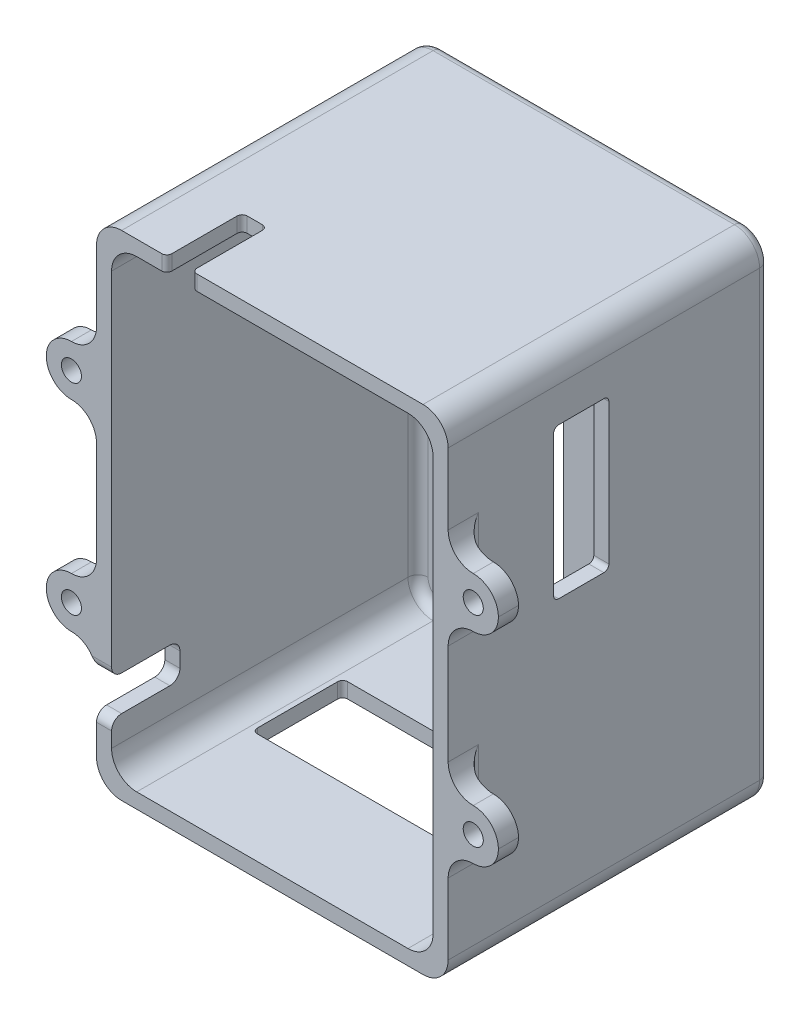
from build123d import *

# Parameters (mm, degrees)
SKETCH1_W           = 64
SKETCH1_H           = 92.29356787
SKETCH1_W_2         = 10
SKETCH1_H_2         = 76.29356787
BOSS_EXTRUDE1_DEPTH = 3
SKETCH1_3_W         = 70
SKETCH1_3_H         = 98.29356787
SKETCH1_3_W_2       = 64
SKETCH1_3_H_2       = 92.29356787
BOSS_EXTRUDE2_DEPTH = 64
FILLET1_R           = 2
FILLET2_R           = 5
SKETCH2_W           = 52
SKETCH2_H           = 18
CUT_EXTRUDE1_DEPTH  = 64
FILLET3_R           = 1
SKETCH3_W           = 11
SKETCH3_H           = 30
CUT_EXTRUDE2_DEPTH  = 45
FILLET4_R           = 1
SKETCH4_W           = 5
SKETCH4_H           = 15
CUT_EXTRUDE3_DEPTH  = 81
FILLET5_R           = 1
SKETCH5_W           = 10
SKETCH5_H           = 10
SKETCH5_R           = 2
BOSS_EXTRUDE3_DEPTH = 4
FILLET6_R           = 5
FILLET7_R           = 5
FILLET8_R           = 2
FILLET9_R           = 2
FILLET10_R          = 2
SKETCH6_W           = 13.6
SKETCH6_H           = 7
CUT_EXTRUDE4_DEPTH  = 48
FILLET11_R          = 2


with BuildPart() as part:
    # Sketch1 → Boss-Extrude1 (new body)
    with BuildSketch(Plane.XY):
        Rectangle(SKETCH1_W, SKETCH1_H)
        with Locations((-24, 0)):
            Rectangle(SKETCH1_W_2, SKETCH1_H_2, mode=Mode.SUBTRACT)
        with Locations((-8, 0)):
            Rectangle(SKETCH1_W_2, SKETCH1_H_2, mode=Mode.SUBTRACT)
        with Locations((8, 0)):
            Rectangle(SKETCH1_W_2, SKETCH1_H_2, mode=Mode.SUBTRACT)
        with Locations((24, 0)):
            Rectangle(SKETCH1_W_2, SKETCH1_H_2, mode=Mode.SUBTRACT)
    extrude(amount=BOSS_EXTRUDE1_DEPTH)

    # Sketch1<3> → Boss-Extrude2 (add)
    with BuildSketch(Plane.XY):
        Rectangle(SKETCH1_3_W, SKETCH1_3_H)
        Rectangle(SKETCH1_3_W_2, SKETCH1_3_H_2, mode=Mode.SUBTRACT)
    extrude(amount=BOSS_EXTRUDE2_DEPTH)

    # Fillet1
    fillet1_edges = [part.edges().sort_by_distance(p)[0] for p in [
        (-19, -38.146783935, 1.5),
        (-19, 38.146783935, 1.5),
        (-29, 38.146783935, 1.5),
        (-29, -38.146783935, 1.5),
        (-13, 38.146783935, 1.5),
        (-13, -38.146783935, 1.5),
        (-3, -38.146783935, 1.5),
        (-3, 38.146783935, 1.5),
        (3, 38.146783935, 1.5),
        (3, -38.146783935, 1.5),
        (13, -38.146783935, 1.5),
        (13, 38.146783935, 1.5),
        (19, 38.146783935, 1.5),
        (19, -38.146783935, 1.5),
        (29, -38.146783935, 1.5),
        (29, 38.146783935, 1.5),
    ]]
    fillet(fillet1_edges, radius=FILLET1_R)

    # Fillet2
    fillet2_edges = [part.edges().sort_by_distance(p)[0] for p in [
        (32, -46.146783935, 33.5),
        (-32, -46.146783935, 33.5),
        (-32, 46.146783935, 33.5),
        (-35, 49.146783935, 32),
        (-35, -49.146783935, 32),
        (35, -49.146783935, 32),
        (35, 49.146783935, 32),
        (32, 46.146783935, 33.5),
    ]]
    fillet(fillet2_edges, radius=FILLET2_R)

    # Sketch2 → Cut-Extrude1 (cut)
    with BuildSketch(Plane(origin=(0, 0, 0), x_dir=(1, 0, 0), z_dir=(0, 1, 0))):
        with Locations((0, -33)):
            Rectangle(SKETCH2_W, SKETCH2_H)
    extrude(amount=-CUT_EXTRUDE1_DEPTH, mode=Mode.SUBTRACT)

    # Fillet3
    fillet3_edges = [part.edges().sort_by_distance(p)[0] for p in [
        (-26, -47.646783935, 42),
        (-26, -47.646783935, 24),
        (26, -47.646783935, 24),
        (26, -47.646783935, 42),
    ]]
    fillet(fillet3_edges, radius=FILLET3_R)

    # Sketch3 → Cut-Extrude2 (cut)
    with BuildSketch(Plane(origin=(0, 0, 0), x_dir=(0, 0, -1), z_dir=(1, 0, 0))):
        with Locations((-37.5, 22.146783935)):
            Rectangle(SKETCH3_W, SKETCH3_H)
    extrude(amount=CUT_EXTRUDE2_DEPTH, mode=Mode.SUBTRACT)

    # Fillet4
    fillet4_edges = [part.edges().sort_by_distance(p)[0] for p in [
        (33.5, 37.146783935, 43),
        (33.5, 7.146783935, 43),
        (33.5, 7.146783935, 32),
        (33.5, 37.146783935, 32),
    ]]
    fillet(fillet4_edges, radius=FILLET4_R)

    # Sketch4 → Cut-Extrude3 (cut)
    with BuildSketch(Plane(origin=(0, 0, 0), x_dir=(1, 0, 0), z_dir=(0, 1, 0))):
        with Locations((-18.5, -56.5)):
            Rectangle(SKETCH4_W, SKETCH4_H)
    extrude(amount=CUT_EXTRUDE3_DEPTH, mode=Mode.SUBTRACT)

    # Fillet5
    fillet5_edges = [part.edges().sort_by_distance(p)[0] for p in [
        (-16, 47.646783935, 64),
        (-21, 47.646783935, 64),
        (-16, 47.646783935, 49),
        (-21, 47.646783935, 49),
    ]]
    fillet(fillet5_edges, radius=FILLET5_R)

    # Sketch5 → Boss-Extrude3 (add)
    # profile 1 of 4: a face of its own
    with BuildSketch(Plane.XY.offset(64)):
        with Locations((40, 20)):
            Rectangle(SKETCH5_W, SKETCH5_H)
        with Locations((40, 20)):
            Circle(SKETCH5_R, mode=Mode.SUBTRACT)
    # profile 2 of 4: a face of its own
    with BuildSketch(Plane.XY.offset(64)):
        with Locations((40, -20)):
            Rectangle(SKETCH5_W, SKETCH5_H)
        with Locations((40, -20)):
            Circle(SKETCH5_R, mode=Mode.SUBTRACT)
    # profile 3 of 4: a face of its own
    with BuildSketch(Plane.XY.offset(64)):
        with Locations((-40, -20)):
            Rectangle(SKETCH5_W, SKETCH5_H)
        with Locations((-40, -20)):
            Circle(SKETCH5_R, mode=Mode.SUBTRACT)
    # profile 4 of 4: a face of its own
    with BuildSketch(Plane.XY.offset(64)):
        with Locations((-40, 20)):
            Rectangle(SKETCH5_W, SKETCH5_H)
        with Locations((-40, 20)):
            Circle(SKETCH5_R, mode=Mode.SUBTRACT)
    extrude(amount=-BOSS_EXTRUDE3_DEPTH)

    # Fillet6
    fillet6_edges = [part.edges().sort_by_distance(p)[0] for p in [
        (35, 15, 62),
        (35, 25, 62),
        (35, -25, 62),
        (35, -15, 62),
        (-35, -15, 62),
        (-35, -25, 62),
        (-35, 25, 62),
        (-35, 15, 62),
    ]]
    fillet(fillet6_edges, radius=FILLET6_R)

    # Fillet7
    fillet7_edges = [part.edges().sort_by_distance(p)[0] for p in [
        (-45, 25, 62),
        (-45, 15, 62),
        (-45, -15, 62),
        (-45, -25, 62),
        (45, -25, 62),
        (45, -15, 62),
        (45, 15, 62),
        (45, 25, 62),
    ]]
    fillet(fillet7_edges, radius=FILLET7_R - 0.0001)  # a hair under: the kernel refuses the full size

    # Fillet8
    fillet8_edges = [part.edges().sort_by_distance(p)[0] for p in [
        (35, 20, 60),
        (35, -20, 60),
        (-35, -20, 60),
        (-35, 20, 60),
    ]]
    fillet(fillet8_edges, radius=FILLET8_R)

    # Fillet9
    fillet9_edges = [part.edges().sort_by_distance(p)[0] for p in [
        (35, 0, 0),
        (-35, 0, 0),
        (0, 49.146783935, 0),
        (0, -49.146783935, 0),
        (-33.535533906, 47.68231784, 0),
        (33.535533906, 47.68231784, 0),
        (-33.535533906, -47.68231784, 0),
        (33.535533906, -47.68231784, 0),
    ]]
    fillet(fillet9_edges, radius=FILLET9_R)

    # Fillet10
    fillet10_edges = [part.edges().sort_by_distance(p)[0] for p in [
        (-32, 0, 3),
        (0, -46.146783935, 3),
        (32, 0, 3),
        (0, 46.146783935, 3),
        (30.535533906, 44.68231784, 3),
        (-30.535533906, 44.68231784, 3),
        (30.535533906, -44.68231784, 3),
        (-30.535533906, -44.68231784, 3),
    ]]
    fillet(fillet10_edges, radius=FILLET10_R)

    # Sketch6 → Cut-Extrude4 (cut)
    with BuildSketch(Plane(origin=(0, 0, 0), x_dir=(0, 0, -1), z_dir=(1, 0, 0))):
        with Locations((-57.2, -32.646783935)):
            Rectangle(SKETCH6_W, SKETCH6_H)
    extrude(amount=-CUT_EXTRUDE4_DEPTH, mode=Mode.SUBTRACT)

    # Fillet11
    fillet11_edges = [part.edges().sort_by_distance(p)[0] for p in [
        (-33.5, -29.146783935, 50.4),
        (-33.5, -36.146783935, 50.4),
        (-33.5, -36.146783935, 64),
        (-33.536667788, -29.146783935, 64),
    ]]
    fillet(fillet11_edges, radius=FILLET11_R)


solid = part.part
